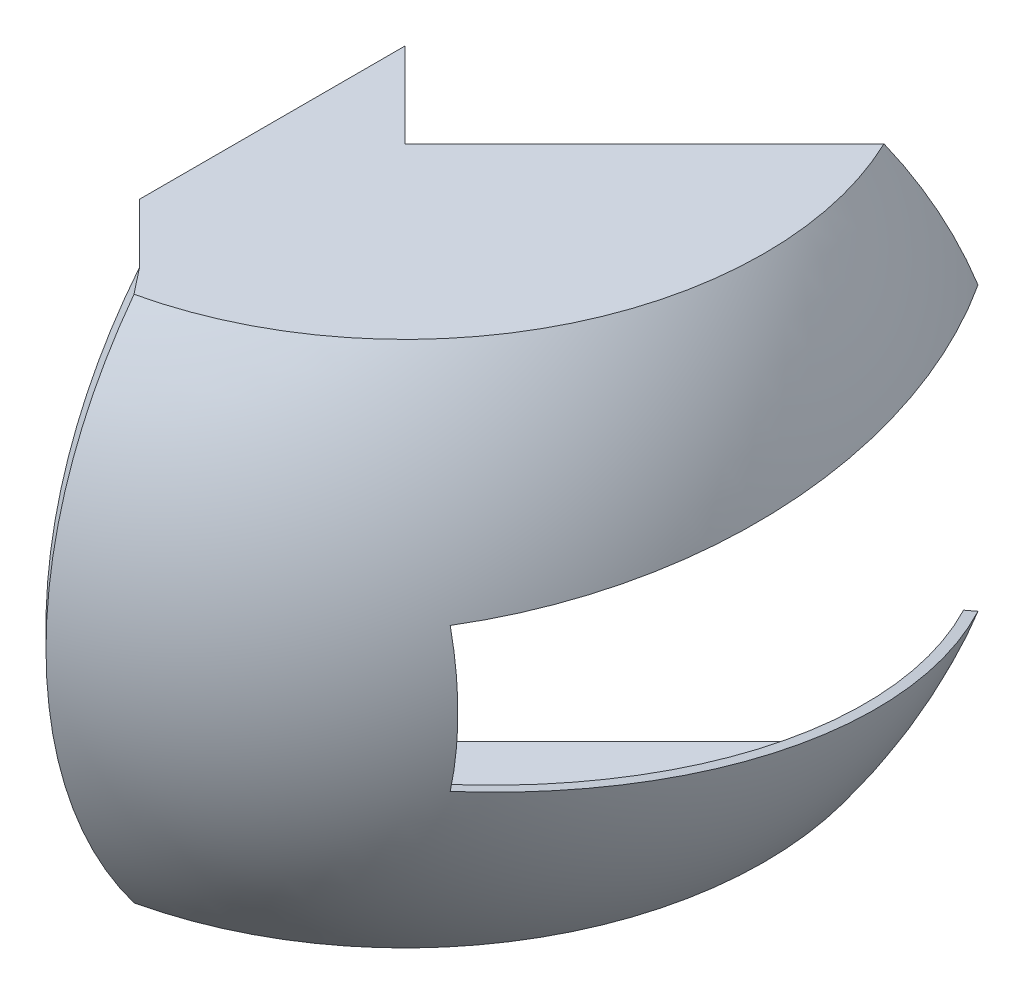
from build123d import *

# Parameters (mm, degrees)
REVOLVE1_ANGLE      = 180
CUT_EXTRUDE1_DEPTH  = 172.464281995
CUT_EXTRUDE2_DEPTH  = 147.710676959
CHAMFER1_SIZE       = 5
SHELL1_T            = -2
BOSS_EXTRUDE1_DEPTH = 2


with BuildPart() as part:
    # Sketch1 → Revolve1 (revolve)
    with BuildSketch(Plane(origin=(0, 0, 0), x_dir=(0, 0, -1), z_dir=(1, 0, 0))):
        with BuildLine():
            Line((0, -55), (0, 55))
            Line((0, 55), (-75, 55))
            ThreePointArc((-75, 55), (-93.005376189, 0), (-75, -55))
            Line((-75, -55), (0, -55))
        make_face()
    revolve(axis=Axis((0, -55, 0), (0, 1, 0)), revolution_arc=REVOLVE1_ANGLE)

    # Sketch2 → Cut-Extrude1 (cut, through all)
    with BuildSketch(Plane.XZ.offset(55)):
        Polygon((0, 0), (0, 40), (12.287280664, 48.603646545), (12.287280664, 112.259604339), (-94.581934809, 112.259604339), (-94.581934809, -108.477643872), (97.057130945, -108.477643872), (97.057130945, -61.701791886), (17.67766953, 17.67766953), align=None)
    extrude(amount=-CUT_EXTRUDE1_DEPTH, mode=Mode.SUBTRACT)

    # Sketch3 → Cut-Extrude2 (cut, through all)
    with BuildSketch(Plane(origin=(100, 0, 0), x_dir=(0, 0, -1), z_dir=(1, 0, 0))):
        Polygon((-60, -15), (-60, 15), (45.666627767, 30), (45.666627767, -30), align=None)
    extrude(amount=-CUT_EXTRUDE2_DEPTH, mode=Mode.SUBTRACT)

    # Chamfer1
    # the kernel refuses this chamfer: 5, 4.450979534 mm, written as the material it takes off along each edge
    with BuildSketch(Plane(origin=(12.287280664, 0, 0), x_dir=(0, 0.7023997796774999, 0.7117826560889214), z_dir=(0, 0.7117826560889214, -0.7023997796774999))) as chamfer1_piece_1:
        with BuildLine():
            Line((92.190144451 - CHAMFER1_SIZE, 0), (91.510568486, 4.320424035))
            ThreePointArc((91.510568486, 4.320424035), (91.866596239, 2.222319448), (92.190144451, 0))
            Line((92.190144451, 0), (92.190144451 - CHAMFER1_SIZE, 0))
        make_face()
    revolve(axis=Axis((12.287280664, 0, 0), (1, 0, 0)), revolution_arc=89.239714317, mode=Mode.SUBTRACT)

    # Shell1
    shell1_openings = [part.faces().sort_by_distance(p)[0] for p in [
        (0, -37.799975499, 20.551470825),
        (44.318791783, -39.564539913, -8.963452724),
        (12.287280664, 0, 66.554150501),
        (8.951756718, -38.623299359, 8.951756718),
        (6.176749303, -36.112578818, 44.325006424),
        (8.951756718, 38.623299359, 8.951756718),
        (44.318791783, 39.564539913, -8.963452724),
        (6.176749303, 36.112578818, 44.325006424),
        (0, 37.799975499, 20.551470825),
        (41.411625019, 0, 60),
        (50.400096072, 20.67683416, 20.009871862),
        (50.400096072, -20.67683416, 20.009871862),
    ]]
    offset(amount=SHELL1_T, openings=shell1_openings)

    # Sketch4 → Boss-Extrude1 (add)
    with BuildSketch(Plane.XZ.offset(55)):
        Polygon((12.287280664, 67.654425497), (0, 55.367144833), (0, 40), (12.287280664, 48.603646545), align=None)
    boss_extrude1 = extrude(amount=-BOSS_EXTRUDE1_DEPTH)

    # Mirror1: Boss-Extrude1 across plane
    add(boss_extrude1.mirror(Plane.ZX))


solid = part.part
